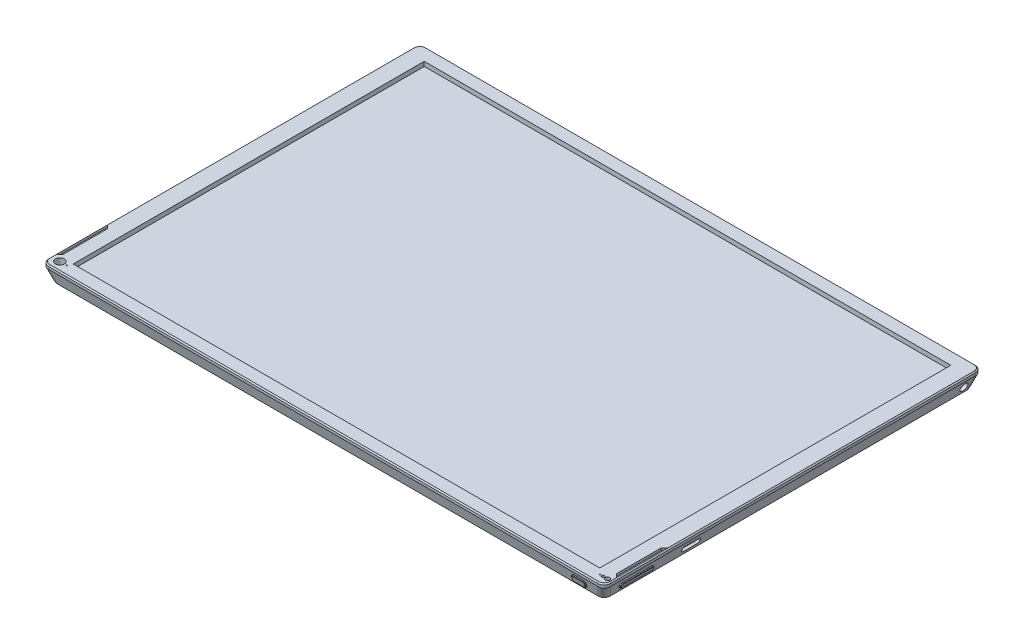
from build123d import *

# Parameters (mm, degrees)
SKETCH2_W           = 252.7
SKETCH2_H           = 169.8
BOSS_EXTRUDE1_DEPTH = 7.3
CUT_EXTRUDE1_DEPTH  = 267.3
CUT_EXTRUDE2_DEPTH  = 267.3
CUT_EXTRUDE3_DEPTH  = 267.3
CUT_EXTRUDE4_DEPTH  = 267.3
FILLET1_R           = 3
SKETCH7_W           = 236.7
SKETCH7_H           = 157.8
CUT_EXTRUDE5_DEPTH  = 2
SKETCH8_R           = 2.5
CUT_EXTRUDE6_DEPTH  = 5
SKETCH9_R           = 3.5
CUT_EXTRUDE7_DEPTH  = 1
SKETCH10_R          = 2
CUT_EXTRUDE9_DEPTH  = 4
SKETCH11_R          = 1
SKETCH11_R_2        = 0.6
CUT_EXTRUDE10_DEPTH = 2
SKETCH12_R          = 0.25
CUT_EXTRUDE11_DEPTH = 2
SKETCH13_R          = 0.25
CUT_EXTRUDE12_DEPTH = 2
CHAMFER1_SIZE       = 0.5
CUT_EXTRUDE13_DEPTH = 1
CUT_EXTRUDE14_DEPTH = 1
SKETCH16_W          = 8.2
SKETCH16_H          = 2.5
CUT_EXTRUDE15_DEPTH = 6
FILLET2_R           = 1
SKETCH17_W          = 7.2
SKETCH17_H          = 0.7
BOSS_EXTRUDE2_DEPTH = 4
FILLET3_R           = 0.3
FILLET4_R           = 0.1
SKETCH18_W          = 8.2
SKETCH18_H          = 2.5
CUT_EXTRUDE16_DEPTH = 6
FILLET5_R           = 1
SKETCH19_W          = 7.2
SKETCH19_H          = 0.7
BOSS_EXTRUDE3_DEPTH = 4
FILLET6_R           = 0.3
FILLET7_R           = 0.1
SKETCH20_W          = 15
SKETCH20_H          = 2
BOSS_EXTRUDE4_DEPTH = 0.6
FILLET8_R           = 0.6
CHAMFER2_SIZE       = 0.2
SKETCH21_W          = 6
SKETCH21_H          = 3
BOSS_EXTRUDE5_DEPTH = 0.6
FILLET9_R           = 0.6
CHAMFER3_SIZE       = 0.2
SKETCH22_R          = 1.75
CUT_EXTRUDE17_DEPTH = 8
FILLET10_R          = 1


with BuildPart() as part:
    # Sketch2 → Boss-Extrude1 (new body)
    with BuildSketch(Plane(origin=(0, 0, 0), x_dir=(1, 0, 0), z_dir=(0, 1, 0))):
        with Locations((-3.110153846, -22.308153846)):
            Rectangle(SKETCH2_W, SKETCH2_H)
    extrude(amount=BOSS_EXTRUDE1_DEPTH)

    # Sketch3 → Cut-Extrude1 (cut)
    with BuildSketch(Plane.ZY.offset(129.460153846)):
        Polygon((-62.591846154, 5.7), (-60.591846154, 0), (-62.591846154, 0), align=None)
    extrude(amount=-CUT_EXTRUDE1_DEPTH, mode=Mode.SUBTRACT)

    # Sketch4 → Cut-Extrude2 (cut)
    with BuildSketch(Plane.ZY.offset(129.460153846)):
        Polygon((107.208153846, 5.7), (105.208153846, 0), (107.208153846, 0), align=None)
    extrude(amount=-CUT_EXTRUDE2_DEPTH, mode=Mode.SUBTRACT)

    # Sketch5 → Cut-Extrude3 (cut)
    with BuildSketch(Plane.XY.offset(107.208153846)):
        Polygon((123.239846154, 5.7), (121.239846154, 0), (123.239846154, 0), align=None)
    extrude(amount=-CUT_EXTRUDE3_DEPTH, mode=Mode.SUBTRACT)

    # Sketch6 → Cut-Extrude4 (cut)
    with BuildSketch(Plane.XY.offset(107.208153846)):
        Polygon((-129.460153846, 5.7), (-127.460153846, 0), (-129.460153846, 0), align=None)
    extrude(amount=-CUT_EXTRUDE4_DEPTH, mode=Mode.SUBTRACT)

    # Fillet1
    # the kernel refuses this fillet: 3 mm, written as the material it takes off along each edge
    with BuildSketch(Plane(origin=(119.128213652, -6.01815263, 103.096521344), x_dir=(0.10406367796097932, 0.2965814821887841, -0.9493209021990074), z_dir=(0.3143084864397732, 0.8957791863533537, 0.3143084864397754)), Plane(origin=(119.128213652, -6.01815263, -58.480213652), x_dir=(-0.9493209021990082, 0.29658148218878294, -0.10406367796097653), z_dir=(0.31430848643977344, 0.8957791863533544, -0.31430848643977355))) as fillet1_piece_1:
        with BuildLine():
            CenterArc((FILLET1_R * 0.895779186353, FILLET1_R), FILLET1_R, 186.293357312, 83.706642688)
            Line((-FILLET1_R * 0.0981944846647, FILLET1_R * 0.890380926281), (0, 0))
            Line((0, 0), (FILLET1_R * 0.895779186353, 0))
        make_face()
    extrude(amount=19.799863103, mode=Mode.SUBTRACT)
    with BuildSketch(Plane(origin=(-125.348521344, -6.01815263, 103.096521344), x_dir=(-0.10406367796097984, 0.2965814821887839, -0.9493209021990074), z_dir=(-0.314308486439775, 0.8957791863533531, 0.3143084864397754)), Plane(origin=(-125.348521344, -6.01815263, -58.480213652), x_dir=(0.9493209021990076, 0.2965814821887847, -0.10406367796097692), z_dir=(-0.3143084864397752, 0.8957791863533539, -0.31430848643977316))) as fillet1_piece_2:
        with BuildLine():
            CenterArc((FILLET1_R * 0.895779186353, -FILLET1_R), FILLET1_R, 90, 83.706642688)
            Line((-FILLET1_R * 0.0981944846647, -FILLET1_R * 0.890380926281), (0, 0))
            Line((0, 0), (FILLET1_R * 0.895779186353, 0))
        make_face()
    extrude(amount=19.799863103, mode=Mode.SUBTRACT)
    with BuildSketch(Plane(origin=(-129.460153846, -1.8, -62.591846154), x_dir=(1, 0, 0), z_dir=(0, 1, 0)), Plane(origin=(-129.460153846, -1.8, 107.208153846), x_dir=(0, 0, -1), z_dir=(0, 1, 0))) as fillet1_piece_3:
        with BuildLine():
            CenterArc((FILLET1_R, -FILLET1_R), FILLET1_R, 90, 90)
            Line((0, -FILLET1_R), (0, 0))
            Line((0, 0), (FILLET1_R, 0))
        make_face()
    extrude(amount=16.6, mode=Mode.SUBTRACT)
    with BuildSketch(Plane(origin=(123.239846154, -1.8, -62.591846154), x_dir=(-1, 0, 0), z_dir=(0, 1, 0)), Plane(origin=(123.239846154, -1.8, 107.208153846), x_dir=(0, 0, -1), z_dir=(0, 1, 0))) as fillet1_piece_4:
        with BuildLine():
            CenterArc((FILLET1_R, FILLET1_R), FILLET1_R, 180, 90)
            Line((0, FILLET1_R), (0, 0))
            Line((0, 0), (FILLET1_R, 0))
        make_face()
    extrude(amount=16.6, mode=Mode.SUBTRACT)

    # Sketch7 → Cut-Extrude5 (cut)
    with BuildSketch(Plane(origin=(0, 7.3, 0), x_dir=(1, 0, 0), z_dir=(0, 1, 0))):
        with Locations((-3.110153846, -22.308153846)):
            Rectangle(SKETCH7_W, SKETCH7_H)
    extrude(amount=-CUT_EXTRUDE5_DEPTH, mode=Mode.SUBTRACT)

    # Sketch8 → Cut-Extrude6 (cut)
    with BuildSketch(Plane.XZ):
        with Locations(Location((116.239846154, 100.208153846, 0), (0, 0, 270))):
            Circle(SKETCH8_R)
    extrude(amount=-CUT_EXTRUDE6_DEPTH, mode=Mode.SUBTRACT)

    # Sketch9 → Cut-Extrude7 (cut)
    with BuildSketch(Plane.XZ):
        with Locations(Location((116.239846154, 100.208153846, 0), (0, 0, 270))):
            Circle(SKETCH9_R)
    extrude(amount=-CUT_EXTRUDE7_DEPTH, mode=Mode.SUBTRACT)

    # Sketch10 → Cut-Extrude9 (cut)
    with BuildSketch(Plane(origin=(0, 7.3, 0), x_dir=(1, 0, 0), z_dir=(0, 1, 0))):
        with Locations(Location((-125.460153846, -103.208153846, 0), (0, 0, 270))):
            Circle(SKETCH10_R)
    extrude(amount=-CUT_EXTRUDE9_DEPTH, mode=Mode.SUBTRACT)

    # Sketch11 → Cut-Extrude10 (cut)
    with BuildSketch(Plane(origin=(0, 7.3, 0), x_dir=(1, 0, 0), z_dir=(0, 1, 0))):
        with Locations(Location((121.239846154, -103.696451218, 0), (0, 0, 270))):
            Circle(SKETCH11_R)
        with Locations(Location((119.239846154, -103.696451218, 0), (0, 0, 270))):
            Circle(SKETCH11_R_2)
    extrude(amount=-CUT_EXTRUDE10_DEPTH, mode=Mode.SUBTRACT)

    # Sketch12 → Cut-Extrude11 (cut)
    with BuildSketch(Plane(origin=(0, 7.3, 0), x_dir=(1, 0, 0), z_dir=(0, 1, 0))):
        with Locations(Location((117.859136623, -103.696451218, 0), (0, 0, 270))):
            Circle(SKETCH12_R)
    extrude(amount=-CUT_EXTRUDE11_DEPTH, mode=Mode.SUBTRACT)

    # Sketch13 → Cut-Extrude12 (cut)
    with BuildSketch(Plane(origin=(0, 7.3, 0), x_dir=(1, 0, 0), z_dir=(0, 1, 0))):
        with Locations(Location((-122.430604142, -103.208153846, 0), (0, 0, 270))):
            Circle(SKETCH13_R)
    extrude(amount=-CUT_EXTRUDE12_DEPTH, mode=Mode.SUBTRACT)

    # Chamfer1
    chamfer1_edges = [part.edges().sort_by_distance(p)[0] for p in [
        (-129.460153846, 7.3, 22.308153846),
        (-3.110153846, 7.3, -62.591846154),
        (-3.110153846, 7.3, 107.208153846),
        (123.239846154, 7.3, 22.308153846),
        (122.361166497, 7.3, -61.713166497),
        (122.361166497, 7.3, 106.32947419),
        (-128.58147419, 7.3, 106.32947419),
        (-128.58147419, 7.3, -61.713166497),
    ]]
    chamfer(chamfer1_edges, length=CHAMFER1_SIZE)

    # Sketch14 → Cut-Extrude13 (cut)
    with BuildSketch(Plane(origin=(0, 7.3, 0), x_dir=(1, 0, 0), z_dir=(0, 1, 0))):
        Polygon((122.739846154, -101.208153846), (121.239846154, -99.708153846), (121.239846154, -79.708153846), (122.739846154, -78.208153846), align=None)
    extrude(amount=-CUT_EXTRUDE13_DEPTH, mode=Mode.SUBTRACT)

    # Sketch15 → Cut-Extrude14 (cut)
    with BuildSketch(Plane(origin=(0, 7.3, 0), x_dir=(1, 0, 0), z_dir=(0, 1, 0))):
        Polygon((-128.960153846, -101.208153846), (-127.460153846, -99.708153846), (-127.460153846, -79.708153846), (-128.960153846, -78.208153846), align=None)
    extrude(amount=-CUT_EXTRUDE14_DEPTH, mode=Mode.SUBTRACT)

    # Sketch16 → Cut-Extrude15 (cut)
    with BuildSketch(Plane.ZY.offset(129.460153846)):
        with Locations((67.108153846, 2.65)):
            Rectangle(SKETCH16_W, SKETCH16_H)
    extrude(amount=-CUT_EXTRUDE15_DEPTH, mode=Mode.SUBTRACT)

    # Fillet2
    fillet2_edges = [part.edges().sort_by_distance(p)[0] for p in [
        (-125.705767881, 1.4, 63.008153846),
        (-126.144364372, 3.9, 63.008153846),
        (-126.144364372, 3.9, 71.208153846),
        (-125.705767881, 1.4, 71.208153846),
    ]]
    fillet(fillet2_edges, radius=FILLET2_R)

    # Sketch17 → Boss-Extrude2 (add)
    with BuildSketch(Plane.ZY.offset(123.460153846)):
        with Locations((67.108153846, 2.67)):
            Rectangle(SKETCH17_W, SKETCH17_H)
    extrude(amount=BOSS_EXTRUDE2_DEPTH)

    # Fillet3
    fillet3_edges = [part.edges().sort_by_distance(p)[0] for p in [
        (-125.460153846, 3.02, 63.508153846),
        (-125.460153846, 2.32, 63.508153846),
        (-125.460153846, 2.32, 70.708153846),
        (-125.460153846, 3.02, 70.708153846),
    ]]
    fillet(fillet3_edges, radius=FILLET3_R)

    # Fillet4
    fillet4_edges = [part.edges().sort_by_distance(p)[0] for p in [
        (-127.460153846, 2.32, 67.108153846),
        (-127.460153846, 2.67, 63.508153846),
        (-127.460153846, 2.67, 70.708153846),
        (-127.460153846, 3.02, 67.108153846),
        (-127.460153846, 2.932132034, 70.620285881),
        (-127.460153846, 2.407867966, 70.620285881),
        (-127.460153846, 2.932132034, 63.596021812),
        (-127.460153846, 2.407867966, 63.596021812),
    ]]
    fillet(fillet4_edges, radius=FILLET4_R)

    # Sketch18 → Cut-Extrude16 (cut)
    with BuildSketch(Plane(origin=(123.239846154, 0, 0), x_dir=(0, 0, -1), z_dir=(1, 0, 0))):
        with Locations((-67.108153846, 2.65)):
            Rectangle(SKETCH18_W, SKETCH18_H)
    extrude(amount=-CUT_EXTRUDE16_DEPTH, mode=Mode.SUBTRACT)

    # Fillet5
    fillet5_edges = [part.edges().sort_by_distance(p)[0] for p in [
        (119.485460189, 1.4, 71.208153846),
        (119.92405668, 3.9, 71.208153846),
        (119.92405668, 3.9, 63.008153846),
        (119.485460189, 1.4, 63.008153846),
    ]]
    fillet(fillet5_edges, radius=FILLET5_R)

    # Sketch19 → Boss-Extrude3 (add)
    with BuildSketch(Plane(origin=(117.239846154, 0, 0), x_dir=(0, 0, -1), z_dir=(1, 0, 0))):
        with Locations((-67.108153846, 2.65)):
            Rectangle(SKETCH19_W, SKETCH19_H)
    extrude(amount=BOSS_EXTRUDE3_DEPTH)

    # Fillet6
    fillet6_edges = [part.edges().sort_by_distance(p)[0] for p in [
        (119.239846154, 3, 70.708153846),
        (119.239846154, 2.3, 70.708153846),
        (119.239846154, 2.3, 63.508153846),
        (119.239846154, 3, 63.508153846),
    ]]
    fillet(fillet6_edges, radius=FILLET6_R)

    # Fillet7
    fillet7_edges = [part.edges().sort_by_distance(p)[0] for p in [
        (121.239846154, 2.65, 63.508153846),
        (121.239846154, 2.3, 67.108153846),
        (121.239846154, 2.65, 70.708153846),
        (121.239846154, 3, 67.108153846),
        (121.239846154, 2.912132034, 70.620285881),
        (121.239846154, 2.387867966, 70.620285881),
        (121.239846154, 2.912132034, 63.596021812),
        (121.239846154, 2.387867966, 63.596021812),
    ]]
    fillet(fillet7_edges, radius=FILLET7_R)

    # Sketch20 → Boss-Extrude4 (add)
    with BuildSketch(Plane(origin=(107.949646521, -37.877068955, 0), x_dir=(0, 0, -1), z_dir=(0.9435999821328808, -0.33108771302908124, 0))):
        with Locations((-91.935662847, 43.181718715)):
            Rectangle(SKETCH20_W, SKETCH20_H)
    extrude(amount=BOSS_EXTRUDE4_DEPTH)

    # Fillet8
    fillet8_edges = [part.edges().sort_by_distance(p)[0] for p in [
        (122.860750722, 3.713473722, 99.435662847),
        (122.198575296, 1.826273758, 99.435662847),
        (122.198575296, 1.826273758, 84.435662847),
        (122.860750722, 3.713473722, 84.435662847),
    ]]
    fillet(fillet8_edges, radius=FILLET8_R)

    # Chamfer2
    chamfer2_edges = [part.edges().sort_by_distance(p)[0] for p in [
        (122.812743004, 2.670547426, 84.435662847),
        (122.481655291, 1.726947444, 91.935662847),
        (122.812743004, 2.670547426, 99.435662847),
        (123.143830717, 3.614147408, 91.935662847),
        (123.085646709, 3.448322986, 99.259926916),
        (122.539839299, 1.892771865, 99.259926916),
        (123.085646709, 3.448322986, 84.611398778),
        (122.539839299, 1.892771865, 84.611398778),
    ]]
    chamfer(chamfer2_edges, length=CHAMFER2_SIZE)

    # Sketch21 → Boss-Extrude5 (add)
    with BuildSketch(Plane(origin=(0, -32.868538061, 93.675333474), x_dir=(1, 0, 0), z_dir=(0, -0.33108771302908124, 0.9435999821328808))):
        with Locations((111.239846154, 37.873822373)):
            Rectangle(SKETCH21_W, SKETCH21_H)
    extrude(amount=BOSS_EXTRUDE5_DEPTH)

    # Fillet9
    fillet9_edges = [part.edges().sort_by_distance(p)[0] for p in [
        (108.239846154, 4.185273713, 106.994602271),
        (108.239846154, 1.354473766, 106.001339132),
        (114.239846154, 1.354473766, 106.001339132),
        (114.239846154, 4.185273713, 106.994602271),
    ]]
    fillet(fillet9_edges, radius=FILLET9_R)

    # Chamfer3
    chamfer3_edges = [part.edges().sort_by_distance(p)[0] for p in [
        (111.239846154, 1.255147453, 106.284419127),
        (108.239846154, 2.670547426, 106.781050696),
        (114.239846154, 2.670547426, 106.781050696),
        (111.239846154, 4.085947399, 107.277682266),
        (114.064110223, 3.920122977, 107.219498258),
        (114.064110223, 1.420971874, 106.342603134),
        (108.415582085, 3.920122977, 107.219498258),
        (108.415582085, 1.420971874, 106.342603134),
    ]]
    chamfer(chamfer3_edges, length=CHAMFER3_SIZE)

    # Sketch22 → Cut-Extrude17 (cut)
    with BuildSketch(Plane(origin=(123.239846154, 0, 0), x_dir=(0, 0, -1), z_dir=(1, 0, 0))):
        with Locations((55.591846154, 2.700386473)):
            Circle(SKETCH22_R)
    extrude(amount=-CUT_EXTRUDE17_DEPTH, mode=Mode.SUBTRACT)

    # Fillet10
    fillet10_edges = [part.edges().sort_by_distance(p)[0] for p in [
        (115.239846154, 2.700386473, -53.841846154),
    ]]
    fillet(fillet10_edges, radius=FILLET10_R)


solid = part.part
